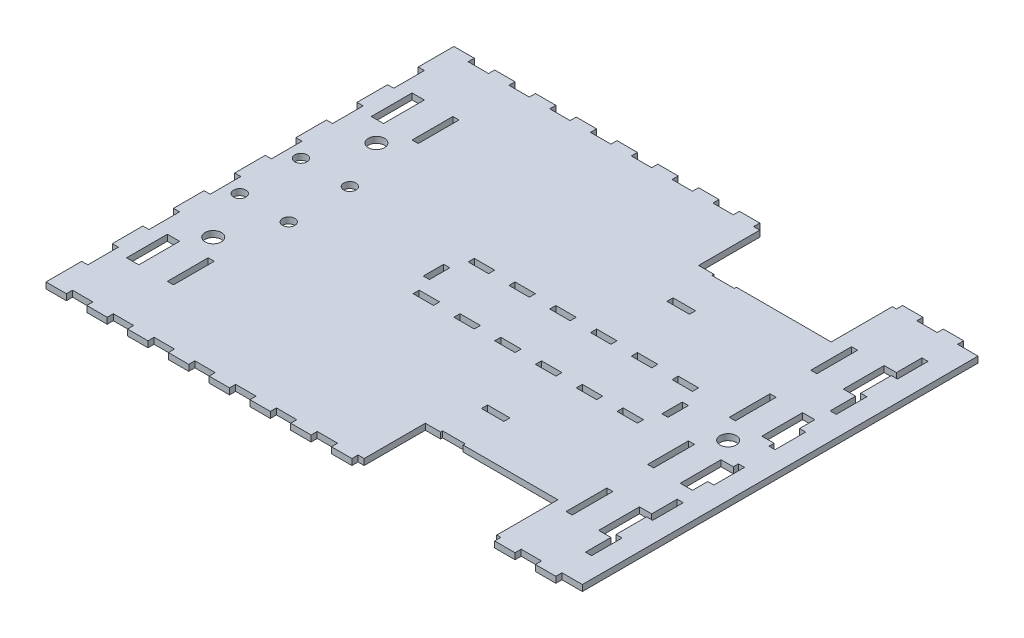
from build123d import *

# Parameters (mm, degrees)
SKETCH3_R             = 3
SKETCH3_W             = 10
SKETCH3_H             = 3
SKETCH3_W_2           = 3
SKETCH3_H_2           = 15
SKETCH3_H_3           = 10
BOSS_EXTRUDE1_DEPTH   = 3
SKETCH5_W             = 11
SKETCH5_H             = 3
CUT_EXTRUDE2_DEPTH    = 10
CROQUIS1_W            = 3
CROQUIS1_H            = 15
CORTAR_EXTRUIR1_DEPTH = 10
CROQUIS2_R            = 4
CROQUIS2_W            = 6
CROQUIS2_H            = 20
CROQUIS2_W_2          = 3
CORTAR_EXTRUIR2_DEPTH = 10


with BuildPart() as part:
    # Sketch3 → Boss-Extrude1 (new body)
    with BuildSketch(Plane(origin=(0, 0, 0), x_dir=(1, 0, 0), z_dir=(0, 1, 0))):
        Polygon((-300, 97), (-300, -97), (-300, -100), (-290, -100), (-290, -97), (-280, -97), (-280, -100), (-270, -100), (-270, -97), (-260, -97), (-260, -100), (-250, -100), (-250, -97), (-240, -97), (-240, -100), (-230, -100), (-230, -97), (-220, -97), (-220, -100), (-210, -100), (-210, -97), (-200, -97), (-200, -100), (-190, -100), (-190, -97), (-180, -97), (-180, -100), (-170, -100), (-170, -97), (-160, -97), (-160, -100), (-150, -100), (-150, -97), (-140, -97), (-140, -100), (-130, -100), (-130, -97), (-120, -97), (-120, -100), (-110, -100), (-110, -97), (-100, -97), (-100, -100), (-90, -100), (-90, -97), (-80, -97), (-80, -100), (-70, -100), (-70, -97), (-60, -97), (-60, -100), (-50, -100), (-50, -97), (-40, -97), (-40, 97), (-50, 97), (-50, 100), (-60, 100), (-60, 97), (-70, 97), (-70, 100), (-80, 100), (-80, 97), (-90, 97), (-90, 100), (-100, 100), (-100, 97), (-110, 97), (-110, 100), (-120, 100), (-120, 97), (-130, 97), (-130, 100), (-140, 100), (-140, 97), (-150, 97), (-150, 100), (-160, 100), (-160, 97), (-170, 97), (-170, 100), (-180, 100), (-180, 97), (-190, 97), (-190, 100), (-200, 100), (-200, 97), (-210, 97), (-210, 100), (-220, 100), (-220, 97), (-230, 97), (-230, 100), (-240, 100), (-240, 97), (-250, 97), (-250, 100), (-260, 100), (-260, 97), (-270, 97), (-270, 100), (-280, 100), (-280, 97), (-290, 97), (-290, 100), (-300, 100), align=None)
        with Locations((-290, -15)):
            Circle(SKETCH3_R, mode=Mode.SUBTRACT)
        with Locations((-266, -15)):
            Circle(SKETCH3_R, mode=Mode.SUBTRACT)
        with Locations((-200, -13.5)):
            Rectangle(SKETCH3_W, SKETCH3_H, mode=Mode.SUBTRACT)
        with Locations((-180, -13.5)):
            Rectangle(SKETCH3_W, SKETCH3_H, mode=Mode.SUBTRACT)
        with Locations((-51.5, -75)):
            Rectangle(SKETCH3_W_2, SKETCH3_H_2, mode=Mode.SUBTRACT)
        with Locations((-160, -13.5)):
            Rectangle(SKETCH3_W, SKETCH3_H, mode=Mode.SUBTRACT)
        with Locations((-140, -13.5)):
            Rectangle(SKETCH3_W, SKETCH3_H, mode=Mode.SUBTRACT)
        with Locations((-120, -13.5)):
            Rectangle(SKETCH3_W, SKETCH3_H, mode=Mode.SUBTRACT)
        with Locations((-51.5, -45)):
            Rectangle(SKETCH3_W_2, SKETCH3_H_2, mode=Mode.SUBTRACT)
        with Locations((-100, -13.5)):
            Rectangle(SKETCH3_W, SKETCH3_H, mode=Mode.SUBTRACT)
        with Locations((-51.5, -15)):
            Rectangle(SKETCH3_W_2, SKETCH3_H_2, mode=Mode.SUBTRACT)
        with Locations((-290, 15)):
            Circle(SKETCH3_R, mode=Mode.SUBTRACT)
        with Locations((-266, 15)):
            Circle(SKETCH3_R, mode=Mode.SUBTRACT)
        with Locations((-208.5, 0)):
            Rectangle(SKETCH3_W_2, SKETCH3_H_3, mode=Mode.SUBTRACT)
        with Locations((-200, 13.5)):
            Rectangle(SKETCH3_W, SKETCH3_H, mode=Mode.SUBTRACT)
        with Locations((-180, 13.5)):
            Rectangle(SKETCH3_W, SKETCH3_H, mode=Mode.SUBTRACT)
        with Locations((-160, 13.5)):
            Rectangle(SKETCH3_W, SKETCH3_H, mode=Mode.SUBTRACT)
        with Locations((-140, 13.5)):
            Rectangle(SKETCH3_W, SKETCH3_H, mode=Mode.SUBTRACT)
        with Locations((-120, 13.5)):
            Rectangle(SKETCH3_W, SKETCH3_H, mode=Mode.SUBTRACT)
        with Locations((-91.5, 0)):
            Rectangle(SKETCH3_W_2, SKETCH3_H_3, mode=Mode.SUBTRACT)
        with Locations((-100, 13.5)):
            Rectangle(SKETCH3_W, SKETCH3_H, mode=Mode.SUBTRACT)
        with Locations((-51.5, 15)):
            Rectangle(SKETCH3_W_2, SKETCH3_H_2, mode=Mode.SUBTRACT)
        with Locations((-51.5, 45)):
            Rectangle(SKETCH3_W_2, SKETCH3_H_2, mode=Mode.SUBTRACT)
        with Locations((-51.5, 75)):
            Rectangle(SKETCH3_W_2, SKETCH3_H_2, mode=Mode.SUBTRACT)
    extrude(amount=BOSS_EXTRUDE1_DEPTH)

    # Sketch5 → Cut-Extrude2 (cut)
    with BuildSketch(Plane(origin=(0, 3, 0), x_dir=(1, 0, 0), z_dir=(0, 1, 0))):
        Polygon((-128.5, 67), (-82, 67), (-82, 97), (-147, 97), (-147, 67), (-139.5, 67), (-139.5, 66), (-128.5, 66), align=None)
        Polygon((-139.5, -67), (-147, -67), (-147, -97), (-82, -97), (-82, -67), (-128.5, -67), (-128.5, -66), (-139.5, -66), align=None)
        with Locations((-134, -45.5)):
            Rectangle(SKETCH5_W, SKETCH5_H)
        with Locations((-134, 45.5)):
            Rectangle(SKETCH5_W, SKETCH5_H)
    extrude(amount=-CUT_EXTRUDE2_DEPTH, mode=Mode.SUBTRACT)


with BuildPart() as cut_extrude2_kept_piece:
    # of the separate pieces the step leaves, the one the design keeps (cut_extrude2_pieces_kept)
    add(part.part.solids().sort_by_distance((-300, 0, -100))[0])

    # Croquis1 → Cortar-Extruir1 (cut)
    with BuildSketch(Plane(origin=(0, 3, 0), x_dir=(1, 0, 0), z_dir=(0, 1, 0))):
        with Locations((-298.5, -75)):
            Rectangle(CROQUIS1_W, CROQUIS1_H)
        with Locations((-298.5, 45)):
            Rectangle(CROQUIS1_W, CROQUIS1_H)
        with Locations((-298.5, 15)):
            Rectangle(CROQUIS1_W, CROQUIS1_H)
        with Locations((-298.5, -15)):
            Rectangle(CROQUIS1_W, CROQUIS1_H)
        with Locations((-298.5, 75)):
            Rectangle(CROQUIS1_W, CROQUIS1_H)
        with Locations((-298.5, -45)):
            Rectangle(CROQUIS1_W, CROQUIS1_H)
    extrude(amount=-CORTAR_EXTRUIR1_DEPTH, mode=Mode.SUBTRACT)

    # Croquis2 → Cortar-Extruir2 (cut)
    with BuildSketch(Plane(origin=(0, 3, 0), x_dir=(1, 0, 0), z_dir=(0, 1, 0))):
        with Locations((-65.5, 0)):
            Circle(CROQUIS2_R)
        with Locations((-278, -40)):
            Circle(CROQUIS2_R)
        with Locations((-278, 40)):
            Circle(CROQUIS2_R)
        with Locations((-56, -20)):
            Rectangle(CROQUIS2_W, CROQUIS2_H)
        with Locations((-56, -60)):
            Rectangle(CROQUIS2_W, CROQUIS2_H)
        with Locations((-56, 60)):
            Rectangle(CROQUIS2_W, CROQUIS2_H)
        with Locations((-56, 20)):
            Rectangle(CROQUIS2_W, CROQUIS2_H)
        with Locations((-73.5, 60)):
            Rectangle(CROQUIS2_W_2, CROQUIS2_H)
        with Locations((-73.5, 20)):
            Rectangle(CROQUIS2_W_2, CROQUIS2_H)
        with Locations((-73.5, -20)):
            Rectangle(CROQUIS2_W_2, CROQUIS2_H)
        with Locations((-73.5, -60)):
            Rectangle(CROQUIS2_W_2, CROQUIS2_H)
        with Locations((-269, -60)):
            Rectangle(CROQUIS2_W_2, CROQUIS2_H)
        with Locations((-269, 60)):
            Rectangle(CROQUIS2_W_2, CROQUIS2_H)
        with Locations((-287.5, 60)):
            Rectangle(CROQUIS2_W, CROQUIS2_H)
        with Locations((-287.5, -60)):
            Rectangle(CROQUIS2_W, CROQUIS2_H)
    extrude(amount=-CORTAR_EXTRUIR2_DEPTH, mode=Mode.SUBTRACT)


solid = cut_extrude2_kept_piece.part
